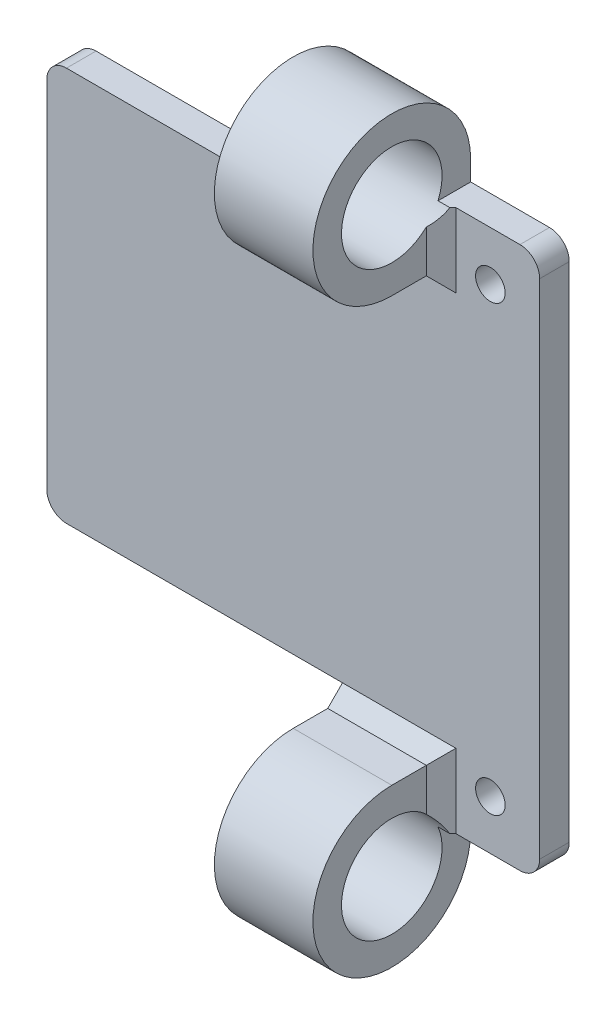
from build123d import *

# Parameters (mm, degrees)
SKETCH1_R           = 1.5
BOSS_EXTRUDE1_DEPTH = 3
FILLET1_R           = 2
BOSS_EXTRUDE2_START = 5
SKETCH2_R           = 5.1
BOSS_EXTRUDE2_DEPTH = 10
CHAMFER1_SIZE       = 2
CHAMFER2_SIZE       = 1.5


with BuildPart() as part:
    # Sketch1 → Boss-Extrude1 (new body)
    with BuildSketch(Plane.XY):
        Polygon((10, -27.5), (25, -27.5), (25, 27.5), (-5, 27.5), (-5, 20), (-25, 20), (-25, -20), (10, -20), align=None)
        with Locations((0, 22.5)):
            Circle(SKETCH1_R, mode=Mode.SUBTRACT)
        with Locations((20, 22.5)):
            Circle(SKETCH1_R, mode=Mode.SUBTRACT)
        with Locations((20, -22.5)):
            Circle(SKETCH1_R, mode=Mode.SUBTRACT)
    extrude(amount=BOSS_EXTRUDE1_DEPTH)

    # Fillet1
    fillet1_edges = [part.edges().sort_by_distance(p)[0] for p in [
        (25, -27.5, 1.5),
        (-25, -20, 1.5),
        (-25, 20, 1.5),
        (25, 27.5, 1.5),
    ]]
    fillet(fillet1_edges, radius=FILLET1_R)

    # Sketch2 → Boss-Extrude2 (add)
    # profile 1 of 2: a face of its own
    with BuildSketch(Plane(origin=(0, 0, 0), x_dir=(0, 0, -1), z_dir=(1, 0, 0)).offset(BOSS_EXTRUDE2_START)):
        with BuildLine():
            ThreePointArc((0, -29.5), (-13.656854249, -35.156854249), (-8, -21.5))
            Line((-8, -21.5), (-3, -21.5))
            Line((-3, -21.5), (-3, -11.5))
            Line((-3, -11.5), (0, -11.5))
            Line((0, -11.5), (0, -29.5))
        make_face()
        with Locations((-8, -29.5)):
            Circle(SKETCH2_R, mode=Mode.SUBTRACT)
    # profile 2 of 2: a face of its own
    with BuildSketch(Plane(origin=(0, 0, 0), x_dir=(0, 0, -1), z_dir=(1, 0, 0)).offset(BOSS_EXTRUDE2_START)):
        with BuildLine():
            Line((0, 11.5), (0, 29.5))
            ThreePointArc((0, 29.5), (-13.656854249, 35.156854249), (-8, 21.5))
            Line((-8, 21.5), (-3, 21.5))
            Line((-3, 21.5), (-3, 11.5))
            Line((-3, 11.5), (0, 11.5))
        make_face()
        with Locations((-8, 29.5)):
            Circle(SKETCH2_R, mode=Mode.SUBTRACT)
    extrude(amount=BOSS_EXTRUDE2_DEPTH)

    # Chamfer1
    chamfer1_edges = [part.edges().sort_by_distance(p)[0] for p in [
        (-5, 20, 1.5),
        (-5, 27.5, 1.5),
    ]]
    chamfer(chamfer1_edges, length=CHAMFER1_SIZE)

    # Chamfer2
    # the kernel refuses this chamfer: 1.5 mm, written as the material it adds along each edge
    with BuildSketch(Plane(origin=(15, -21.5, 3), x_dir=(-0.02749587661058678, 0, 0.9996219169112968), z_dir=(0, -1, 0))) as chamfer2_piece_1_section:
        Polygon((CHAMFER2_SIZE * 0.999621916911, -CHAMFER2_SIZE * 0.0274958766106), (-CHAMFER2_SIZE * 0.0274958766106, -CHAMFER2_SIZE * 0.999621916911), (0, 0), align=None)
    chamfer2_piece_1 = extrude(amount=6, mode=Mode.PRIVATE)
    chamfer2_piece_1 = chamfer2_piece_1 - Plane(origin=(15.512165711, -29.5, 8), x_dir=(0, 0, -1), z_dir=(-1, 0, 0)) * Cylinder(5.1, 18, mode=Mode.PRIVATE)
    add(chamfer2_piece_1)
    with BuildSketch(Plane(origin=(5, -21.5, 3), x_dir=(0, 0.9996219169112968, -0.02749587661058648), z_dir=(1, 0, 0))) as chamfer2_piece_2_section:
        Polygon((CHAMFER2_SIZE * 0.999621916911, CHAMFER2_SIZE * 0.0274958766106), (-CHAMFER2_SIZE * 0.0274958766106, CHAMFER2_SIZE * 0.999621916911), (0, 0), align=None)
    chamfer2_piece_2 = extrude(amount=10, mode=Mode.PRIVATE)
    chamfer2_piece_2 = split(chamfer2_piece_2, bisect_by=Plane(origin=(10, -20, 3.495606231), z_dir=(0, -1, 0)), keep=Keep.TOP, mode=Mode.PRIVATE)
    add(chamfer2_piece_2)
    with BuildSketch(Plane(origin=(15, 21.5, 3), x_dir=(-0.02749587661058678, 0, 0.9996219169112968), z_dir=(0, 1, 0))) as chamfer2_piece_3_section:
        Polygon((CHAMFER2_SIZE * 0.999621916911, CHAMFER2_SIZE * 0.0274958766106), (-CHAMFER2_SIZE * 0.0274958766106, CHAMFER2_SIZE * 0.999621916911), (0, 0), align=None)
    chamfer2_piece_3 = extrude(amount=6, mode=Mode.PRIVATE)
    chamfer2_piece_3 = chamfer2_piece_3 - Plane(origin=(15.512165714, 29.5, 8), x_dir=(0, 0, -1), z_dir=(-1, 0, 0)) * Cylinder(5.1, 18, mode=Mode.PRIVATE)
    add(chamfer2_piece_3)
    with BuildSketch(Plane(origin=(5, 21.5, 3), x_dir=(0.027495876610586206, 0, 0.9996219169112968), z_dir=(0, 1, 0))) as chamfer2_piece_4_section:
        Polygon((CHAMFER2_SIZE * 0.999621916911, -CHAMFER2_SIZE * 0.0274958766106), (-CHAMFER2_SIZE * 0.0274958766106, -CHAMFER2_SIZE * 0.999621916911), (0, 0), align=None)
    chamfer2_piece_4 = extrude(amount=6, mode=Mode.PRIVATE)
    chamfer2_piece_4 = chamfer2_piece_4 - Plane(origin=(4.487834286, 29.5, 8), x_dir=(0, 0, -1), z_dir=(-1, 0, 0)) * Cylinder(5.1, 18, mode=Mode.PRIVATE)
    add(chamfer2_piece_4)
    with BuildSketch(Plane(origin=(5, 21.5, 3), x_dir=(0, -0.9996219169112968, -0.02749587661058648), z_dir=(1, 0, 0))) as chamfer2_piece_5:
        Polygon((CHAMFER2_SIZE * 0.999621916911, -CHAMFER2_SIZE * 0.0274958766106), (-CHAMFER2_SIZE * 0.0274958766106, -CHAMFER2_SIZE * 0.999621916911), (0, 0), align=None)
    extrude(amount=10)
    with BuildSketch(Plane(origin=(15, -17.642475518, 3), x_dir=(-0.02749587661058678, 0, 0.9996219169112968), z_dir=(0, -1, 0))) as chamfer2_piece_6a_section:
        Polygon((CHAMFER2_SIZE * 0.999621916911, -CHAMFER2_SIZE * 0.0274958766106), (-CHAMFER2_SIZE * 0.0274958766106, -CHAMFER2_SIZE * 0.999621916911), (0, 0), align=None)
    chamfer2_piece_6a = extrude(amount=9.857524482, mode=Mode.PRIVATE)
    chamfer2_piece_6a = split(chamfer2_piece_6a, bisect_by=Plane(origin=(15.49469044, -21.5, 3.49469044), z_dir=(0, 1, 0)), keep=Keep.TOP, mode=Mode.PRIVATE)
    with BuildSketch(Plane(origin=(5, -21.5, 3), x_dir=(0, 0.9996219169112968, -0.02749587661058648), z_dir=(1, 0, 0))) as chamfer2_piece_6b_section:
        Polygon((CHAMFER2_SIZE * 0.999621916911, CHAMFER2_SIZE * 0.0274958766106), (-CHAMFER2_SIZE * 0.0274958766106, CHAMFER2_SIZE * 0.999621916911), (0, 0), align=None)
    chamfer2_piece_6b = extrude(amount=13.857524482, mode=Mode.PRIVATE)
    chamfer2_piece_6b = split(chamfer2_piece_6b, bisect_by=Plane(origin=(16.928692538, -20, 3.495574544), z_dir=(0, -1, 0)), keep=Keep.TOP, mode=Mode.PRIVATE)
    chamfer2_piece_6b = split(chamfer2_piece_6b, bisect_by=Plane(origin=(15, -21.007028814, 3.495574544), z_dir=(1, 0, 0)), keep=Keep.TOP, mode=Mode.PRIVATE)
    chamfer2_piece_6b = chamfer2_piece_6b - Plane(origin=(20, -22.5, 3.495574544), x_dir=(1, 0, 0), z_dir=(0, 0, -1)) * Cylinder(1.5, 34, mode=Mode.PRIVATE)
    chamfer2_piece_6 = chamfer2_piece_6a & chamfer2_piece_6b
    add(chamfer2_piece_6)
    with BuildSketch(Plane(origin=(15, 17.642475518, 3), x_dir=(-0.02749587661058678, 0, 0.9996219169112968), z_dir=(0, 1, 0))) as chamfer2_piece_7a_section:
        Polygon((CHAMFER2_SIZE * 0.999621916911, CHAMFER2_SIZE * 0.0274958766106), (-CHAMFER2_SIZE * 0.0274958766106, CHAMFER2_SIZE * 0.999621916911), (0, 0), align=None)
    chamfer2_piece_7a = extrude(amount=9.857524482, mode=Mode.PRIVATE)
    chamfer2_piece_7a = split(chamfer2_piece_7a, bisect_by=Plane(origin=(15.49469044, 21.5, 3.49469044), z_dir=(0, -1, 0)), keep=Keep.TOP, mode=Mode.PRIVATE)
    with BuildSketch(Plane(origin=(5, 21.5, 3), x_dir=(0, -0.9996219169112968, -0.02749587661058648), z_dir=(1, 0, 0))) as chamfer2_piece_7b_section:
        Polygon((CHAMFER2_SIZE * 0.999621916911, -CHAMFER2_SIZE * 0.0274958766106), (-CHAMFER2_SIZE * 0.0274958766106, -CHAMFER2_SIZE * 0.999621916911), (0, 0), align=None)
    chamfer2_piece_7b = extrude(amount=13.857524482, mode=Mode.PRIVATE)
    chamfer2_piece_7b = split(chamfer2_piece_7b, bisect_by=Plane(origin=(15, 21.005289845, 3.494658773), z_dir=(1, 0, 0)), keep=Keep.TOP, mode=Mode.PRIVATE)
    chamfer2_piece_7b = chamfer2_piece_7b - Plane(origin=(20, 22.5, 3.494658773), x_dir=(1, 0, 0), z_dir=(0, 0, -1)) * Cylinder(1.5, 34, mode=Mode.PRIVATE)
    chamfer2_piece_7 = chamfer2_piece_7a & chamfer2_piece_7b
    add(chamfer2_piece_7)
    with BuildSketch(Plane(origin=(5, 17.642475518, 3), x_dir=(0.027495876610586206, 0, 0.9996219169112968), z_dir=(0, 1, 0))) as chamfer2_piece_8a_section:
        Polygon((CHAMFER2_SIZE * 0.999621916911, -CHAMFER2_SIZE * 0.0274958766106), (-CHAMFER2_SIZE * 0.0274958766106, -CHAMFER2_SIZE * 0.999621916911), (0, 0), align=None)
    chamfer2_piece_8a = extrude(amount=9.857524482, mode=Mode.PRIVATE)
    chamfer2_piece_8a = split(chamfer2_piece_8a, bisect_by=Plane(origin=(4.50530956, 21.5, 3.49469044), z_dir=(0, -1, 0)), keep=Keep.TOP, mode=Mode.PRIVATE)
    with BuildSketch(Plane(origin=(1.142475518, 21.5, 3), x_dir=(0, -0.9996219169112968, -0.02749587661058648), z_dir=(1, 0, 0))) as chamfer2_piece_8b_section:
        Polygon((CHAMFER2_SIZE * 0.999621916911, -CHAMFER2_SIZE * 0.0274958766106), (-CHAMFER2_SIZE * 0.0274958766106, -CHAMFER2_SIZE * 0.999621916911), (0, 0), align=None)
    chamfer2_piece_8b = extrude(amount=13.857524482, mode=Mode.PRIVATE)
    chamfer2_piece_8b = split(chamfer2_piece_8b, bisect_by=Plane(origin=(5, 21.005289845, 3.494658773), z_dir=(-1, 0, 0)), keep=Keep.TOP, mode=Mode.PRIVATE)
    chamfer2_piece_8b = chamfer2_piece_8b - Plane(origin=(0, 22.5, 3.494658773), x_dir=(1, 0, 0), z_dir=(0, 0, -1)) * Cylinder(1.5, 34, mode=Mode.PRIVATE)
    chamfer2_piece_8 = chamfer2_piece_8a & chamfer2_piece_8b
    add(chamfer2_piece_8)


solid = part.part
